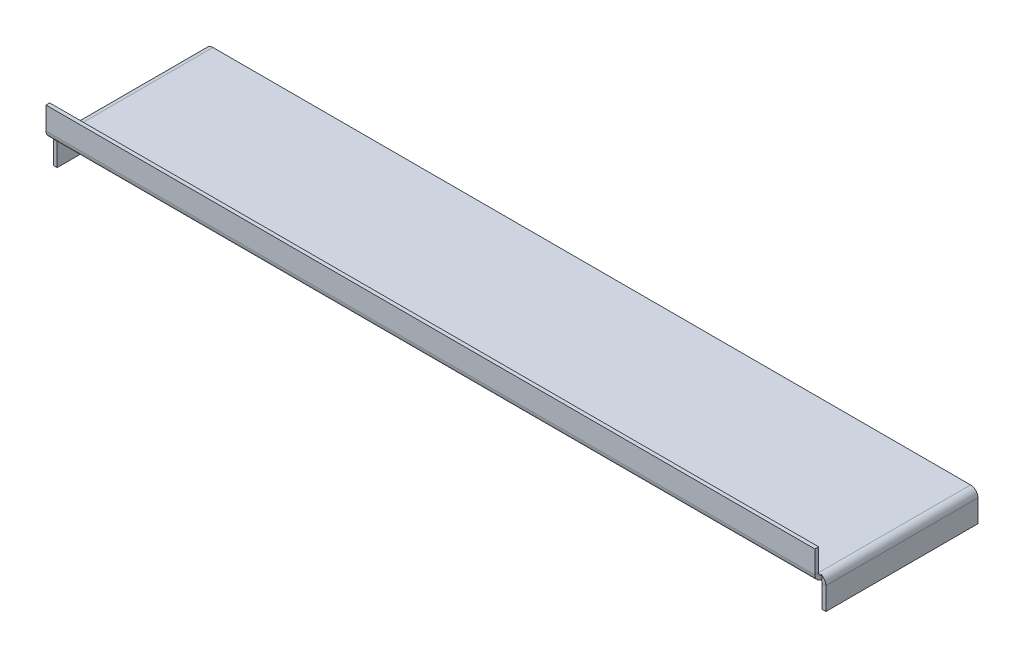
from build123d import *

# Parameters (mm, degrees)
SKETCH1_W                    = 489.688000048
SKETCH1_H                    = 101.6
BASE_FLANGE1_DEPTH           = 2.3622
EDGE_FLANGE1_STRIP_W         = 14.1688
EDGE_FLANGE1_STRIP_H         = 2.3622
EDGE_FLANGE1_STRIP_CUT_DEPTH = 489.688000048
EDGE_FLANGE1_DEPTH           = 489.688000048
EDGE_FLANGE2_STRIP_W         = 14.1688
EDGE_FLANGE2_STRIP_H         = 2.3622
EDGE_FLANGE2_STRIP_CUT_DEPTH = 96.8778
EDGE_FLANGE2_DEPTH           = 96.8778
EDGE_FLANGE3_STRIP_W         = 14.1688
EDGE_FLANGE3_STRIP_H         = 2.3622
EDGE_FLANGE3_STRIP_CUT_DEPTH = 96.8778
EDGE_FLANGE3_DEPTH           = 96.8778


# Sheet-metal steps are written as plain solids
with BuildPart() as part:
    # Sketch1 → Base-Flange1 (new body)
    with BuildSketch(Plane(origin=(0, 0, 0), x_dir=(1, 0, 0), z_dir=(0, 1, 0))):
        Rectangle(SKETCH1_W, SKETCH1_H)
    extrude(amount=-BASE_FLANGE1_DEPTH)

    # Edge-Flange1 strip (across the edge) → Edge-Flange1 strip cut (cut)
    with BuildSketch(Plane(origin=(-244.844000024, 0, 50.8), x_dir=(0, 0, -1), z_dir=(1, 0, 0))):
        with Locations((-2.3622, -1.1811)):
            Rectangle(EDGE_FLANGE1_STRIP_W, EDGE_FLANGE1_STRIP_H)
    extrude(amount=EDGE_FLANGE1_STRIP_CUT_DEPTH, mode=Mode.SUBTRACT)

    # Edge-Flange1 section (across the edge) → Edge-Flange1 (add)
    with BuildSketch(Plane(origin=(-244.844000024, 0, 50.8), x_dir=(0, 0, -1), z_dir=(1, 0, 0))):
        with BuildLine():
            Line((0, 2.36), (0, 16.6878))
            Line((0, 16.6878), (2.3622, 16.6878))
            Line((2.3622, 16.6878), (2.3622, 2.36))
            ThreePointArc((2.3622, 2.36), (3.053427996, 0.691227996), (4.7222, 0))
            Line((4.7222, 0), (4.7222, -2.3622))
            ThreePointArc((4.7222, -2.3622), (1.383100358, -0.979099642), (0, 2.36))
        make_face()
    extrude(amount=EDGE_FLANGE1_DEPTH)

    # Edge-Flange2 strip (across the edge) → Edge-Flange2 strip cut (cut)
    with BuildSketch(Plane(origin=(-244.844000024, -2.3622, 46.0778), x_dir=(1, 0, 0), z_dir=(0, 0, -1))):
        with Locations((-2.3622, -1.1811)):
            Rectangle(EDGE_FLANGE2_STRIP_W, EDGE_FLANGE2_STRIP_H)
    extrude(amount=EDGE_FLANGE2_STRIP_CUT_DEPTH, mode=Mode.SUBTRACT)

    # Edge-Flange2 section (across the edge) → Edge-Flange2 (add)
    with BuildSketch(Plane(origin=(-244.844000024, -2.3622, 46.0778), x_dir=(1, 0, 0), z_dir=(0, 0, -1))):
        with BuildLine():
            Line((0, 2.36), (0, 16.6878))
            Line((0, 16.6878), (2.3622, 16.6878))
            Line((2.3622, 16.6878), (2.3622, 2.36))
            ThreePointArc((2.3622, 2.36), (3.053427996, 0.691227996), (4.7222, 0))
            Line((4.7222, 0), (4.7222, -2.3622))
            ThreePointArc((4.7222, -2.3622), (1.383100358, -0.979099642), (0, 2.36))
        make_face()
    extrude(amount=EDGE_FLANGE2_DEPTH)

    # Edge-Flange3 strip (across the edge) → Edge-Flange3 strip cut (cut)
    with BuildSketch(Plane(origin=(244.844000024, -2.3622, -50.8), x_dir=(-1, 0, 0), z_dir=(0, 0, 1))):
        with Locations((-4.7244, -1.1811)):
            Rectangle(EDGE_FLANGE3_STRIP_W, EDGE_FLANGE3_STRIP_H)
    extrude(amount=EDGE_FLANGE3_STRIP_CUT_DEPTH, mode=Mode.SUBTRACT)

    # Edge-Flange3 section (across the edge) → Edge-Flange3 (add)
    with BuildSketch(Plane(origin=(244.844000024, -2.3622, -50.8), x_dir=(-1, 0, 0), z_dir=(0, 0, 1))):
        with BuildLine():
            Line((-2.3622, 2.36), (-2.3622, 16.6878))
            Line((-2.3622, 16.6878), (0, 16.6878))
            Line((0, 16.6878), (0, 2.36))
            ThreePointArc((0, 2.36), (0.691227996, 0.691227996), (2.36, 0))
            Line((2.36, 0), (2.36, -2.3622))
            ThreePointArc((2.36, -2.3622), (-0.979099642, -0.979099642), (-2.3622, 2.36))
        make_face()
    extrude(amount=EDGE_FLANGE3_DEPTH)


solid = part.part
